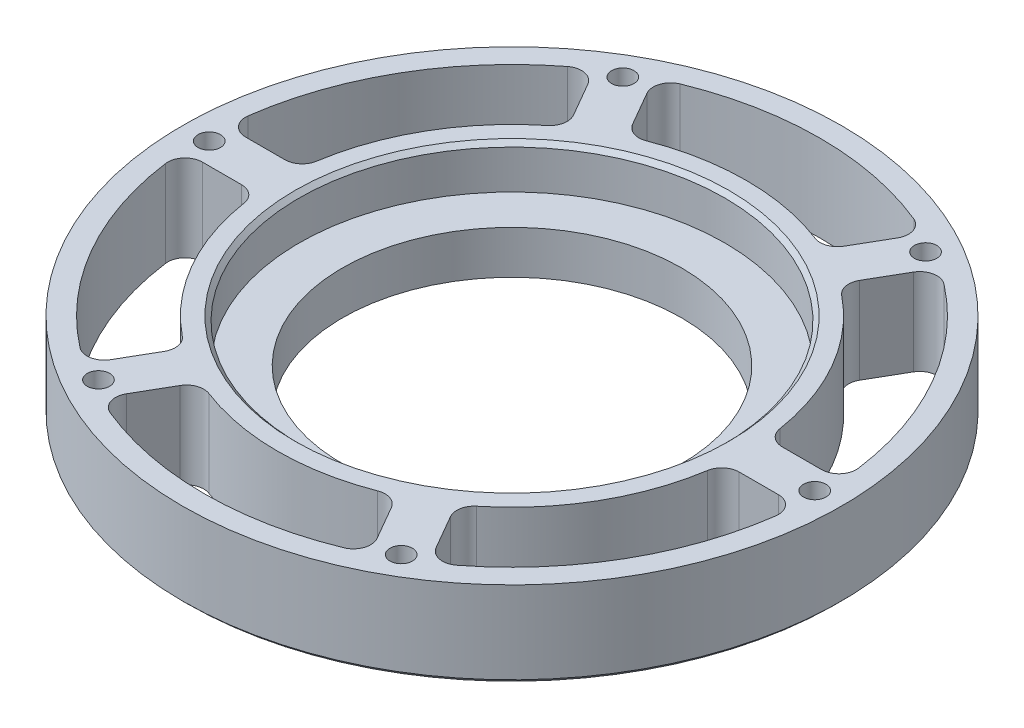
from build123d import *

# Parameters (mm, degrees)
F_6_0_204_DIAMETER_HOLE1_D = 5.1816
CIRPATTERN3_COUNT          = 6
CUT_EXTRUDE1_DEPTH         = 110.60328462231413
FILLET1_R                  = 4
CIRPATTERN4_COUNT          = 6
FILLET1_OF_CIRPATTERN4_R   = 4
CHAMFER1_SIZE              = 1
CHAMFER2_SIZE              = 1


with BuildPart() as part:
    # Sketch2 → Revolve1 (revolve)
    with BuildSketch(Plane(origin=(0, 0, 0), x_dir=(0, 0, -1), z_dir=(1, 0, 0))):
        Polygon((-39.2125, -8.7e-16), (-76.2, -4.53e-15), (-76.2, 19.999999999999996), (-49.2125, 19.999999999999993), (-49.21250000000001, 9.999999999999993), (-39.21250000000001, 9.999999999999991), align=None)
    revolve(axis=Axis((0, -1.000000000000006, 0), (0, 1, 0)))

    # #6 (0.204) Diameter Hole1 (through all)
    with Locations(Plane(origin=(0, 19.999999999999996, 0), x_dir=(1, 0, 0), z_dir=(0, 1, 0))):
        with Locations((-35, 60.621778265)):
            f_6_0_204_diameter_hole1 = Hole(F_6_0_204_DIAMETER_HOLE1_D / 2)

    # CirPattern3: #6 (0.204) Diameter Hole1 ×6 about axis
    cirpattern3_axis = Axis((0, -1.000000000000006, 0), (0, 1, 0))
    for i in range(1, CIRPATTERN3_COUNT):
        add(f_6_0_204_diameter_hole1.rotate(cirpattern3_axis, i * 360 / CIRPATTERN3_COUNT), mode=Mode.SUBTRACT)

    # Sketch8 → Cut-Extrude1 (cut, through all)
    with BuildSketch(Plane(origin=(0, 19.999999999999996, 0), x_dir=(1, 0, 0), z_dir=(0, 1, 0))):
        with BuildLine():
            Line((-31.181983591403508, 64.0087798610897), (-22.660589701137393, 49.249292691841845))
            ThreePointArc((-22.660589701137393, 49.249292691841845), (3.32e-15, 54.212500000000006), (22.660589701137393, 49.249292691841845))
            Line((22.660589701137393, 49.249292691841845), (31.181983591403508, 64.0087798610897))
            ThreePointArc((31.181983591403508, 64.0087798610897), (4.36e-15, 71.2), (-31.181983591403508, 64.0087798610897))
        make_face()
    cut_extrude1 = extrude(amount=-CUT_EXTRUDE1_DEPTH, mode=Mode.SUBTRACT)

    # Fillet1
    fillet1_edges = [part.edges().sort_by_distance(p)[0] for p in [
        (31.18198359140351, 9.999999999999998, -64.00877986108972),
        (22.660589701137397, 9.999999999999998, -49.249292691841845),
        (-31.181983591403515, 9.999999999999998, -64.00877986108972),
        (-22.660589701137393, 9.999999999999998, -49.249292691841845),
    ]]
    fillet(fillet1_edges, radius=FILLET1_R)

    # CirPattern4: Cut-Extrude1 ×6 about axis
    cirpattern4_axis = Axis((0, -1.000000000000006, 0), (0, 1, 0))
    for i in range(1, CIRPATTERN4_COUNT):
        add(cut_extrude1.rotate(cirpattern4_axis, i * 360 / CIRPATTERN4_COUNT), mode=Mode.SUBTRACT)

    # Fillet1 of CirPattern4
    fillet1_of_cirpattern4_edges = [part.edges().sort_by_distance(p)[0] for p in [
        (-39.842237629247705, 9.999999999999998, -59.008779861089835),
        (-31.320843738981637, 9.999999999999998, -44.24929269184193),
        (-71.02422122065123, 9.999999999999998, -4.9999999999999005),
        (-53.981433440119034, 9.999999999999998, -4.999999999999929),
        (-71.02422122065123, 9.999999999999998, 4.999999999999879),
        (-53.981433440119034, 9.999999999999998, 4.999999999999904),
        (-39.84223762924772, 9.999999999999998, 59.00877986108982),
        (-31.32084373898165, 9.999999999999998, 44.249292691841916),
        (-31.18198359140352, 9.999999999999998, 64.00877986108972),
        (-22.660589701137404, 9.999999999999998, 49.249292691841845),
        (31.181983591403508, 9.999999999999998, 64.00877986108972),
        (22.660589701137386, 9.999999999999998, 49.249292691841845),
        (39.842237629247684, 9.999999999999998, 59.00877986108985),
        (31.320843738981612, 9.999999999999998, 44.249292691841944),
        (71.02422122065123, 9.999999999999998, 4.999999999999929),
        (53.98143344011903, 9.999999999999998, 4.999999999999947),
        (71.02422122065123, 9.999999999999998, -4.999999999999904),
        (53.981433440119034, 9.999999999999998, -4.999999999999925),
        (39.842237629247705, 9.999999999999998, -59.008779861089835),
        (31.320843738981637, 9.999999999999998, -44.24929269184193),
    ]]
    fillet(fillet1_of_cirpattern4_edges, radius=FILLET1_OF_CIRPATTERN4_R)

    # Chamfer1
    chamfer1_edges = [part.edges().sort_by_distance(p)[0] for p in [
        (6.03e-15, 19.999999999999993, -49.2125),
    ]]
    chamfer(chamfer1_edges, length=CHAMFER1_SIZE)

    # Chamfer2
    chamfer2_edges = [part.edges().sort_by_distance(p)[0] for p in [
        (9.33e-15, -4.44e-15, -76.2),
    ]]
    chamfer(chamfer2_edges, length=CHAMFER2_SIZE)


solid = part.part
